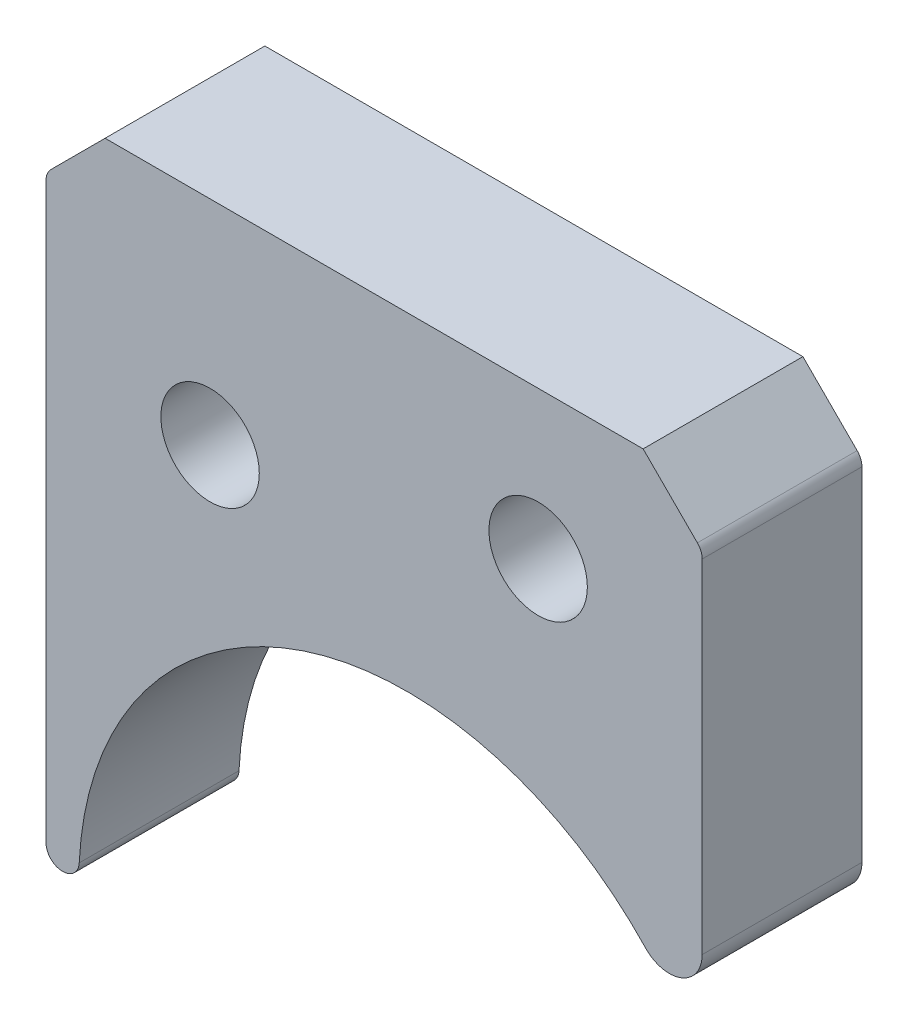
from build123d import *

# Parameters (mm, degrees)
BOSS_EXTRUDE1_DEPTH = 4.87
SKETCH2_R           = 1.5
CUT_EXTRUDE1_DEPTH  = 4.87
CHAMFER1_SIZE       = 1.8
FILLET1_R           = 0.5
FILLET2_R           = 1


with BuildPart() as part:
    # Sketch1 → Boss-Extrude1 (new body)
    with BuildSketch(Plane.XY):
        with BuildLine():
            Line((0, 0), (1, 0))
            ThreePointArc((1, 0), (8.763932023, 9.746794345), (20, 4.358898944))
            Line((20, 4.358898944), (20, 20))
            Line((20, 20), (0, 20))
            Line((0, 20), (0, 0))
        make_face()
    extrude(amount=BOSS_EXTRUDE1_DEPTH)

    # Sketch2 → Cut-Extrude1 (cut)
    with BuildSketch(Plane.XY.offset(4.87)):
        with Locations((5, 13.5)):
            Circle(SKETCH2_R)
        with Locations((15, 15.5)):
            Circle(SKETCH2_R)
    extrude(amount=-CUT_EXTRUDE1_DEPTH, mode=Mode.SUBTRACT)

    # Chamfer1
    chamfer1_edges = [part.edges().sort_by_distance(p)[0] for p in [
        (0, 20, 2.435),
        (20, 20, 2.435),
    ]]
    chamfer(chamfer1_edges, length=CHAMFER1_SIZE)

    # Fillet1
    fillet1_edges = [part.edges().sort_by_distance(p)[0] for p in [
        (0, 0, 2.435),
        (1, 0, 2.435),
        (20, 18.2, 2.435),
        (0, 18.2, 2.435),
    ]]
    fillet(fillet1_edges, radius=FILLET1_R)

    # Fillet2
    fillet2_edges = [part.edges().sort_by_distance(p)[0] for p in [
        (20, 4.358898944, 2.435),
    ]]
    fillet(fillet2_edges, radius=FILLET2_R)


solid = part.part
